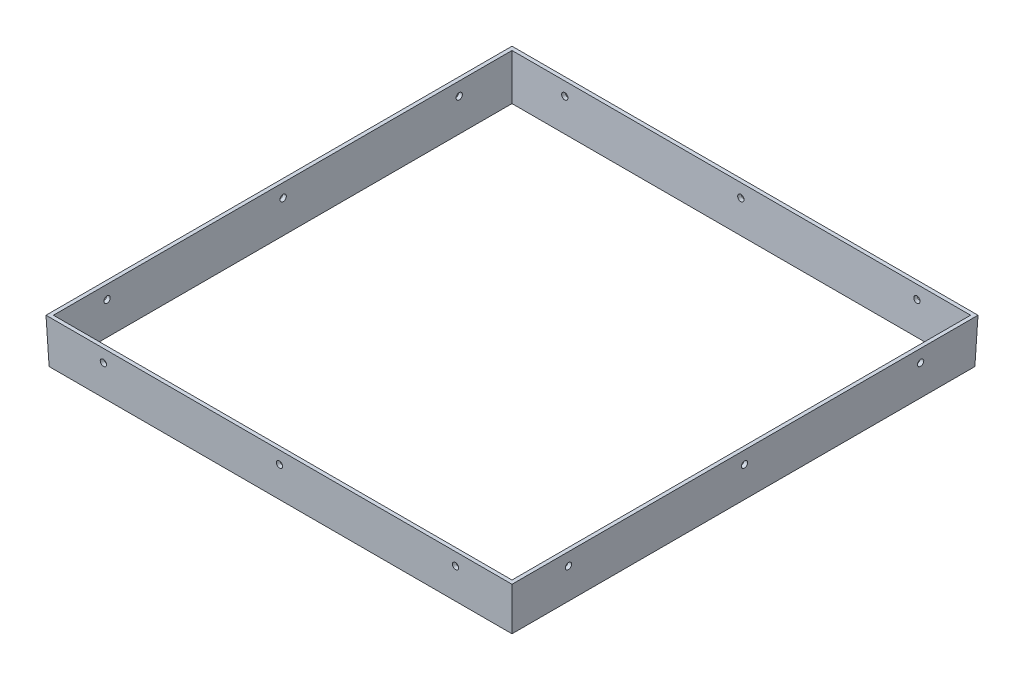
from build123d import *

# Parameters (mm, degrees)
SKETCH2_W           = 249.76
SKETCH2_H           = 249.76
BOSS_EXTRUDE1_DEPTH = 24
BOSS_EXTRUDE1_DRAFT = -2
SHELL1_T            = -2
CUT_EXTRUDE1_START  = -10
SKETCH3_R           = 1.7
CUT_EXTRUDE1_DEPTH  = 292.659861895
SKETCH4_R           = 1.7
CUT_EXTRUDE2_DEPTH  = 10


with BuildPart() as part:
    # Sketch2 → Boss-Extrude1 (with draft: the straight prism first)
    with BuildSketch(Plane(origin=(0, 0, 0), x_dir=(1, 0, 0), z_dir=(0, 1, 0))):
        Rectangle(SKETCH2_W, SKETCH2_H)
    extrude(amount=BOSS_EXTRUDE1_DEPTH)
    # Boss-Extrude1: the draft: its side faces are tilted about the plane it starts from
    boss_extrude1_sides = [part.faces().sort_by_distance(p)[0] for p in [
        (0, 12, 124.88),
        (124.88, 12, 0),
        (0, 12, -124.88),
        (-124.88, 12, 0),
    ]]
    draft(boss_extrude1_sides, Plane(origin=(0, 0, 0), x_dir=(1, 0, 0), z_dir=(0, 1, 0)), BOSS_EXTRUDE1_DRAFT)

    # Shell1
    shell1_openings = [part.faces().sort_by_distance(p)[0] for p in [
        (0, 0, 0),
        (0, 24, 0),
    ]]
    offset(amount=SHELL1_T, openings=shell1_openings, kind=Kind.INTERSECTION)

    # Sketch3 → Cut-Extrude1 (cut)
    with BuildSketch(Plane(origin=(-124.727899298, -4.355594221, 0), x_dir=(0, 0, 1), z_dir=(-0.9993908270190958, -0.03489949670250105, 0)).offset(CUT_EXTRUDE1_START)):
        with Locations((-95, 21.372878211)):
            Circle(SKETCH3_R)
        with Locations((0, 21.372878211)):
            Circle(SKETCH3_R)
        with Locations((95, 21.372878211)):
            Circle(SKETCH3_R)
    cut_extrude1 = extrude(amount=CUT_EXTRUDE1_DEPTH, mode=Mode.SUBTRACT)

    # Mirror1: Cut-Extrude1 across plane
    add(cut_extrude1.mirror(Plane(origin=(0, 0, 0), x_dir=(0, 0, 1), z_dir=(1, 0, 0))), mode=Mode.SUBTRACT)

    # Sketch4 → Cut-Extrude2 (cut)
    with BuildSketch(Plane(origin=(0, -4.355594221, -124.727899298), x_dir=(-1, 0, 0), z_dir=(0, -0.03489949670250105, -0.9993908270190958))):
        with Locations((-95, 21.372878211)):
            Circle(SKETCH4_R)
        with Locations((0, 21.372878211)):
            Circle(SKETCH4_R)
        with Locations((95, 21.372878211)):
            Circle(SKETCH4_R)
    cut_extrude2 = extrude(amount=-CUT_EXTRUDE2_DEPTH, mode=Mode.SUBTRACT)

    # Mirror2: Cut-Extrude2 across plane
    add(cut_extrude2.mirror(Plane.XY), mode=Mode.SUBTRACT)


solid = part.part
